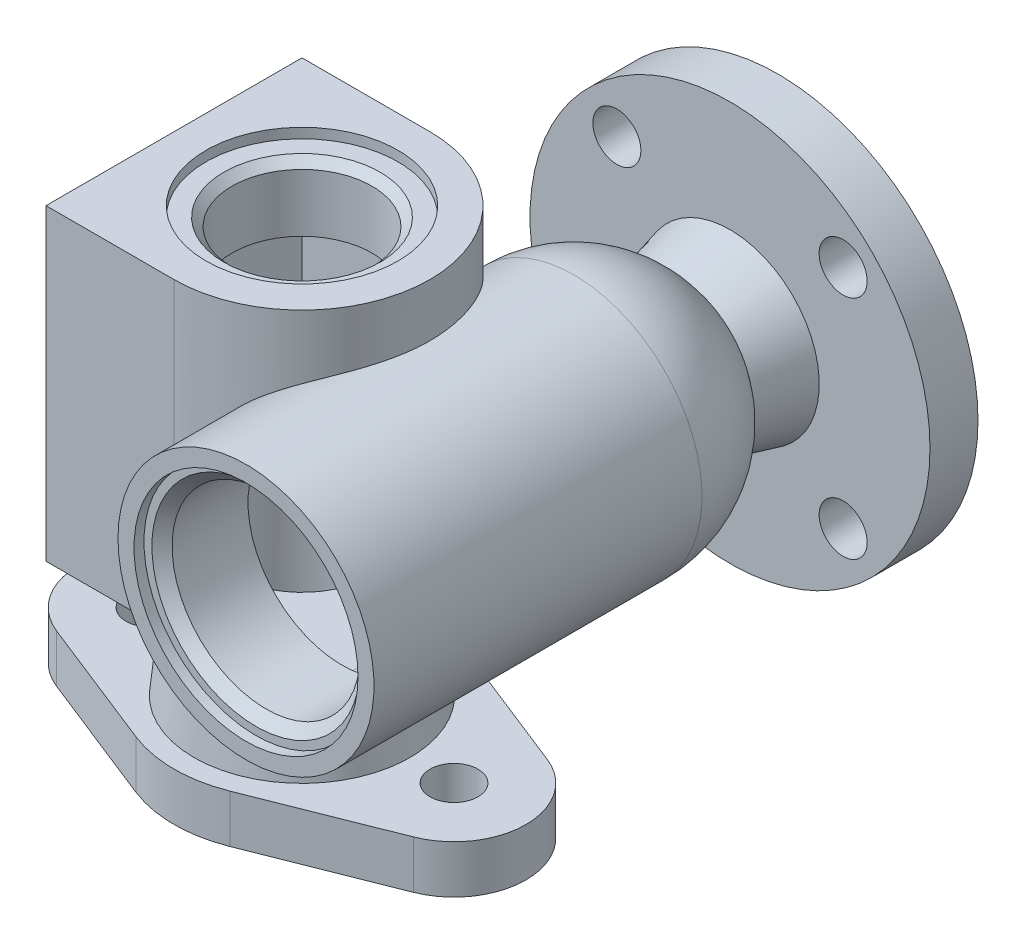
from build123d import *

# Parameters (mm, degrees)
SKETCH_1_R                    = 30
EXTRUDE_1_DEPTH               = 2
SKETCH_2_R                    = 50
EXTRUDE_2_DEPTH               = 12
EXTRUDE_4_DEPTH               = 45
EXTRUDE_4_DEPTH_BACK          = 32
EXTRUDE_START                 = 12
EXTRUDE_5_DEPTH               = 12
SKETCH_9_R                    = 24
EXTRUDE_6_DEPTH               = 2
CUT_EXTRUDE_1_DEPTH           = 26
SKETCH_11_R                   = 28
CUT_EXTRUDE_2_DEPTH           = 2.5
CUT_EXTRUDE_3_REACH           = 181.761
SKETCH_14_R                   = 12.5
CUT_EXTRUDE_START             = -16
SKETCH_15_R                   = 16
CUT_EXTRUDE_4_DEPTH           = 8
HOLE_WIZARD_M33_1_D           = 29.5
HOLE_WIZARD_M33_1_DEPTH       = 16
HOLE_WIZARD_M33_1_CSINK_D     = 33.05
HOLE_WIZARD_M33_1_CSINK_ANGLE = 90
HOLE_WIZARD_M33_1_TIP         = 8.862694131
CHAMFER_1_SIZE                = 1
FILLET_1_R                    = 1
SKETCH_19_R                   = 24
CUT_EXTRUDE_5_DEPTH           = 2.5
SKETCH_22_R                   = 18
CUT_EXTRUDE_6_DEPTH           = 181.180465165
CHAMFER_2_SIZE                = 1
CUT_EXTRUDE_7_REACH           = 206.494
SKETCH_23_R                   = 6
CUT_EXTRUDE_8_REACH           = 180.264
SKETCH_24_R                   = 6
PATTERN_CIRCULAR_1_COUNT      = 4


# Read off the part's stored shape, not the designer's step: 边界1
with BuildPart() as part:
    # 草图1 → 凸台-拉伸1 (new body)
    with BuildSketch(Plane.XY):
        Circle(SKETCH_1_R)
    extrude(amount=EXTRUDE_1_DEPTH)

    # 草图2 → 凸台-拉伸2 (add)
    with BuildSketch(Plane.XY.offset(2)):
        Circle(SKETCH_2_R)
    extrude(amount=EXTRUDE_2_DEPTH)

    # 草图3 → 旋转1 (revolve)
    with BuildSketch(Plane(origin=(0, 0, 0), x_dir=(1, 0, 0), z_dir=(0, 1, 0))):
        with BuildLine():
            Line((0, -53), (0, -14))
            Line((0, -14), (-22.312803405, -14))
            Line((-22.312803405, -14), (-19, -27.251213621))
            ThreePointArc((-19, -27.251213621), (-28.565713714, -38.577794898), (-32, -53))
            Line((-32, -53), (-32, -135))
            Line((-32, -135), (0, -135))
            Line((0, -135), (0, -53))
        make_face()
    revolve(axis=Axis((0, 0, 135), (0, 0, 1)))

    # 草图5 → 凸台-拉伸4 (add, two sides: drawn at the far end of the back side and taken through both)
    with BuildSketch(Plane(origin=(0, 0, 0), x_dir=(1, 0, 0), z_dir=(0, 1, 0)).offset(-EXTRUDE_4_DEPTH_BACK)):
        with BuildLine():
            Line((-36, -53), (-68, -53))
            Line((-68, -53), (-68, -117))
            Line((-68, -117), (-36, -117))
            ThreePointArc((-36, -117), (-4, -85), (-36, -53))
        make_face()
    extrude(amount=EXTRUDE_4_DEPTH + EXTRUDE_4_DEPTH_BACK)

    # 边界1 outline → 边界1 (revolve)
    with BuildSketch(Plane(origin=(-36, 0, 85), x_dir=(1, 0, 0), z_dir=(0, 0, 1))):
        Polygon((0, -61), (27, -61), (24, -32), (0, -32), align=None)
    revolve(axis=Axis((-36, 0, 85), (0, 1, 0)))

    # 草图8 → 凸台-拉伸5 (add)
    with BuildSketch(Plane(origin=(0, -61, 0), x_dir=(-1, 0, 0), z_dir=(0, -1, 0)).offset(EXTRUDE_START)):
        with BuildLine():
            Line((47.789473684, -55.250910766), (80.631578947, -68.266137306))
            ThreePointArc((80.631578947, -68.266137306), (92, -85), (80.631578947, -101.733862694))
            Line((80.631578947, -101.733862694), (47.789473684, -114.749089234))
            ThreePointArc((47.789473684, -114.749089234), (36, -117), (24.210526316, -114.749089234))
            Line((24.210526316, -114.749089234), (-8.631578947, -101.733862694))
            ThreePointArc((-8.631578947, -101.733862694), (-20, -85), (-8.631578947, -68.266137306))
            Line((-8.631578947, -68.266137306), (24.210526316, -55.250910766))
            ThreePointArc((24.210526316, -55.250910766), (36, -53), (47.789473684, -55.250910766))
        make_face()
    extrude(amount=-EXTRUDE_5_DEPTH)

    # 草图9 → 凸台-拉伸6 (add)
    with BuildSketch(Plane.XZ.offset(73)):
        with Locations(Location((-36, 85, 0), (0, 0, 270))):
            Circle(SKETCH_9_R)
    extrude(amount=EXTRUDE_6_DEPTH)

    # 草图10 → 切除-拉伸1 (cut, symmetric)
    with BuildSketch(Plane.XY.offset(85)):
        with BuildLine():
            Line((0, 26), (-62, 26))
            Line((-62, 26), (-62, -26))
            Line((-62, -26), (0, -26))
            ThreePointArc((0, -26), (26, 0), (0, 26))
        make_face()
    extrude(amount=CUT_EXTRUDE_1_DEPTH, both=True, mode=Mode.SUBTRACT)

    # 草图11 → 切除-拉伸2 (cut)
    with BuildSketch(Plane.XY.offset(135)):
        Circle(SKETCH_11_R)
    extrude(amount=-CUT_EXTRUDE_2_DEPTH, mode=Mode.SUBTRACT)

    # 草图13 → M52x5.0 螺纹孔1 (revolve, cut)
    with BuildSketch(Plane(origin=(0, 0, 132.5), x_dir=(0, -1, 0), z_dir=(1, 0, 0))):
        Polygon((0, 0), (0, 21.5), (23.5, 21.5), (23.5, 2.525), (26.025, 0), align=None)
    revolve(axis=Axis((0, 0, 138.85), (0, 0, -1)), mode=Mode.SUBTRACT)

    # 草图14 → 切除-拉伸3 (cut, up to next)
    with BuildSketch(Plane(origin=(0, 0, 0), x_dir=(-1, 0, 0), z_dir=(0, 0, -1)), mode=Mode.PRIVATE) as cut_extrude_3_sk1:
        Circle(SKETCH_14_R)
    cut_extrude_3_tool1 = extrude(cut_extrude_3_sk1.sketch, amount=-CUT_EXTRUDE_3_REACH, mode=Mode.PRIVATE) & part.part
    add(cut_extrude_3_tool1.solids().sort_by_distance((0, 0, 0))[0], mode=Mode.SUBTRACT)

    # 草图15 → 切除-拉伸4 (cut)
    with BuildSketch(Plane.XY.offset(59).offset(CUT_EXTRUDE_START)):
        Circle(SKETCH_15_R)
    extrude(amount=-CUT_EXTRUDE_4_DEPTH, mode=Mode.SUBTRACT)

    # M33 螺纹孔1
    with Locations(Plane.XY.offset(59)):
        with Locations((0, 0)):
            CounterSinkHole(HOLE_WIZARD_M33_1_D / 2, HOLE_WIZARD_M33_1_CSINK_D / 2, depth=HOLE_WIZARD_M33_1_DEPTH, counter_sink_angle=HOLE_WIZARD_M33_1_CSINK_ANGLE)
            with Locations((0, 0, -(HOLE_WIZARD_M33_1_DEPTH + HOLE_WIZARD_M33_1_TIP / 2))):  # 118° drill point
                Cone(0, HOLE_WIZARD_M33_1_D / 2, HOLE_WIZARD_M33_1_TIP, mode=Mode.SUBTRACT)

    # 倒角1
    chamfer_1_edges = [part.edges().sort_by_distance(p)[0] for p in [
        (14.75, 0, 43),
    ]]
    chamfer(chamfer_1_edges, length=CHAMFER_1_SIZE)

    # 圆角1
    # the kernel refuses this fillet: 1 mm, written as the material it adds along each edge
    with BuildSketch(Plane(origin=(0, 0, 43), x_dir=(1, 0, 0), z_dir=(0, -1, 0))) as fillet_1_piece_1:
        with BuildLine():
            CenterArc((15, -0.661437828), FILLET_1_R, 0, 41.409622109)
            Line((16, -0.661437828), (16.02, -0.661437828))
            Line((16.02, -0.661437828), (16.02, 0))
            Line((16.02, 0), (16, 0.02))
            ThreePointArc((16, 0.02), (15.875, 0.02), (15.765, 0.013228757))
            Line((15.765, 0.013228757), (15.75, 0))
        make_face()
    revolve(axis=Axis((0, 0, 43), (0, 0, 1)))
    with BuildSketch(Plane(origin=(0, 0, 35), x_dir=(1, 0, 0), z_dir=(0, -1, 0))) as fillet_1_piece_2:
        with BuildLine():
            CenterArc((16 - FILLET_1_R, FILLET_1_R), FILLET_1_R, 270, 90)
            Line((16 - FILLET_1_R, 0), (16 - FILLET_1_R, -FILLET_1_R * 0.02))
            Line((16 - FILLET_1_R, -FILLET_1_R * 0.02), (16 + FILLET_1_R * 0.02, -FILLET_1_R * 0.02))
            Line((16 + FILLET_1_R * 0.02, -FILLET_1_R * 0.02), (16 + FILLET_1_R * 0.02, FILLET_1_R))
            Line((16 + FILLET_1_R * 0.02, FILLET_1_R), (16, FILLET_1_R))
        make_face()
    revolve(axis=Axis((0, 0, 35), (0, 0, 1)))

    # 草图19 → 切除-拉伸5 (cut)
    with BuildSketch(Plane(origin=(0, 45, 0), x_dir=(1, 0, 0), z_dir=(0, 1, 0))):
        with Locations(Location((-36, -85, 0), (0, 0, 90))):
            Circle(SKETCH_19_R)
    extrude(amount=-CUT_EXTRUDE_5_DEPTH, mode=Mode.SUBTRACT)

    # 草图21 → M39 螺纹孔1 (revolve, cut)
    with BuildSketch(Plane(origin=(-36, 42.5, 85), x_dir=(0, 0, 1), z_dir=(1, 0, 0))):
        Polygon((0, 0), (0, 16.5), (17.5, 16.5), (17.5, 2.025), (19.525, 0), align=None)
    revolve(axis=Axis((-36, 48.85, 85), (0, -1, 0)), mode=Mode.SUBTRACT)

    # 草图22 → 切除-拉伸6 (cut, through all)
    with BuildSketch(Plane(origin=(0, -26, 0), x_dir=(1, 0, 0), z_dir=(0, 1, 0))):
        with Locations(Location((-36, -85, 0), (0, 0, 270))):
            Circle(SKETCH_22_R)
    extrude(amount=-CUT_EXTRUDE_6_DEPTH, mode=Mode.SUBTRACT)

    # 倒角2
    chamfer_2_edges = [part.edges().sort_by_distance(p)[0] for p in [
        (-36, -75, 67),
    ]]
    chamfer(chamfer_2_edges, length=CHAMFER_2_SIZE)

    # 草图23 → 切除-拉伸7 (cut, up to next)
    with BuildSketch(Plane.XZ.offset(73), mode=Mode.PRIVATE) as cut_extrude_7_sk1:
        with Locations(Location((-74, 85, 0), (0, 0, 270))):
            Circle(SKETCH_23_R)
    cut_extrude_7_tool1 = extrude(cut_extrude_7_sk1.sketch, amount=-CUT_EXTRUDE_7_REACH, mode=Mode.PRIVATE) & part.part
    # 草图23 → 切除-拉伸7 (cut, up to next)
    with BuildSketch(Plane.XZ.offset(73), mode=Mode.PRIVATE) as cut_extrude_7_sk2:
        with Locations(Location((2, 85, 0), (0, 0, 270))):
            Circle(SKETCH_23_R)
    cut_extrude_7_tool2 = extrude(cut_extrude_7_sk2.sketch, amount=-CUT_EXTRUDE_7_REACH, mode=Mode.PRIVATE) & part.part
    add(cut_extrude_7_tool1.solids().sort_by_distance((-74, -73, 85))[0], mode=Mode.SUBTRACT)
    add(cut_extrude_7_tool2.solids().sort_by_distance((2, -73, 85))[0], mode=Mode.SUBTRACT)

    # 草图24 → 切除-拉伸8 (cut, up to next)
    with BuildSketch(Plane(origin=(0, 0, 2), x_dir=(-1, 0, 0), z_dir=(0, 0, -1)), mode=Mode.PRIVATE) as cut_extrude_8_sk1:
        with Locations((28.284271247, 28.284271247)):
            Circle(SKETCH_24_R)
    cut_extrude_8_tool1 = extrude(cut_extrude_8_sk1.sketch, amount=-CUT_EXTRUDE_8_REACH, mode=Mode.PRIVATE) & part.part
    cut_extrude_8 = cut_extrude_8_tool1.solids().sort_by_distance((-28.284271, 28.284271, 2))[0]
    add(cut_extrude_8, mode=Mode.SUBTRACT)

    # 阵列(圆周)1: 切除-拉伸8 ×4 about axis
    pattern_circular_1_axis = Axis((0, 0, 0), (0, 0, 1))
    for i in range(1, PATTERN_CIRCULAR_1_COUNT):
        add(cut_extrude_8.rotate(pattern_circular_1_axis, i * 360 / PATTERN_CIRCULAR_1_COUNT), mode=Mode.SUBTRACT)


solid = part.part
